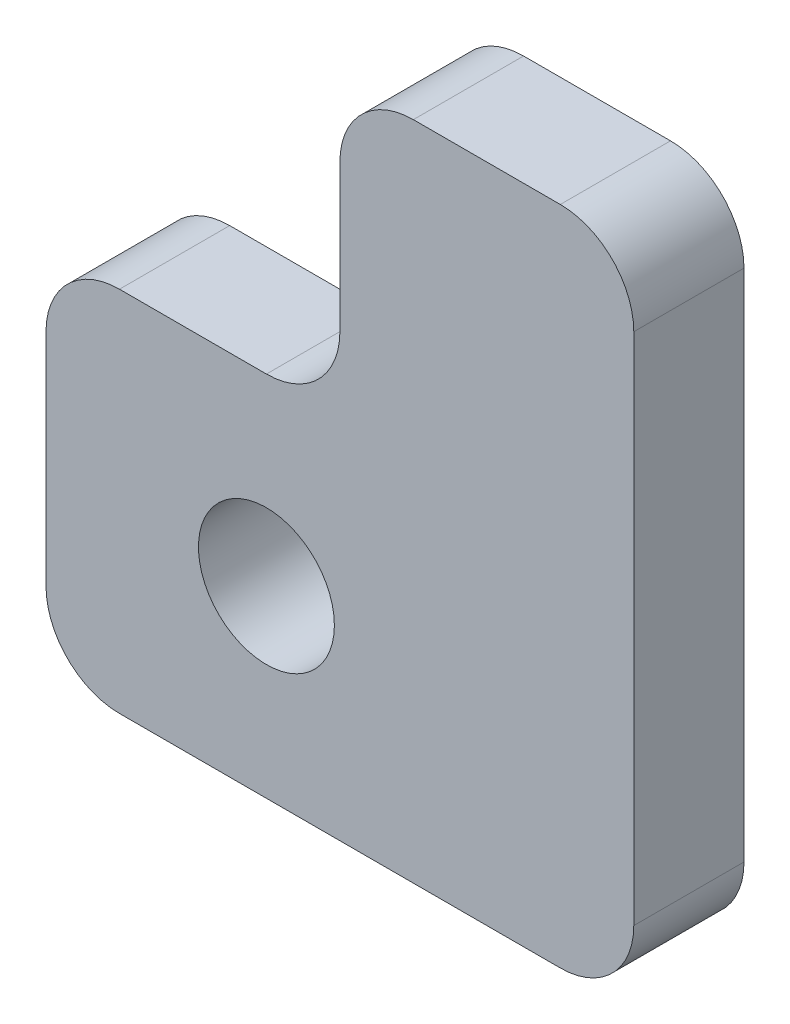
from build123d import *

# Parameters (mm, degrees)
BOSS_EXTRUDE3_DEPTH = 12
SKETCH4_R           = 1.85
CUT_EXTRUDE1_DEPTH  = 12
SKETCH5_W           = 3
SKETCH5_H           = 18
BOSS_EXTRUDE4_DEPTH = 4
FILLET2_R           = 2


with BuildPart() as part:
    # Sketch3 → Boss-Extrude3 (new body)
    with BuildSketch(Plane.ZY.offset(178.52034041)):
        Polygon((-3, 14.935767061), (-5.250229512, 13.135583451), (-3, 11.335399842), (-3, 8.134419599), (0, 8.134419599), (0, 18.136747304), (-3, 18.136747304), align=None)
    extrude(amount=-BOSS_EXTRUDE3_DEPTH)

    # Sketch4 → Cut-Extrude1 (cut)
    with BuildSketch(Plane.XY):
        with Locations((-172.52034041, 13.136747304)):
            Circle(SKETCH4_R)
    extrude(amount=-CUT_EXTRUDE1_DEPTH, mode=Mode.SUBTRACT)

    # Sketch5 → Boss-Extrude4 (add, symmetric)
    with BuildSketch(Plane(origin=(-166.52034041, 0, 0), x_dir=(0, 0, -1), z_dir=(1, 0, 0))):
        with Locations((1.5, 17.134419599)):
            Rectangle(SKETCH5_W, SKETCH5_H)
    extrude(amount=BOSS_EXTRUDE4_DEPTH, both=True)

    # Fillet2
    fillet2_edges = [part.edges().sort_by_distance(p)[0] for p in [
        (-178.52034041, 8.134419599, -1.5),
        (-178.52034041, 18.136747304, -1.5),
        (-162.52034041, 8.134419599, -1.5),
        (-162.52034041, 26.134419599, -1.5),
        (-170.52034041, 18.136747304, -1.5),
        (-170.52034041, 26.134419599, -1.5),
    ]]
    fillet(fillet2_edges, radius=FILLET2_R)


solid = part.part
